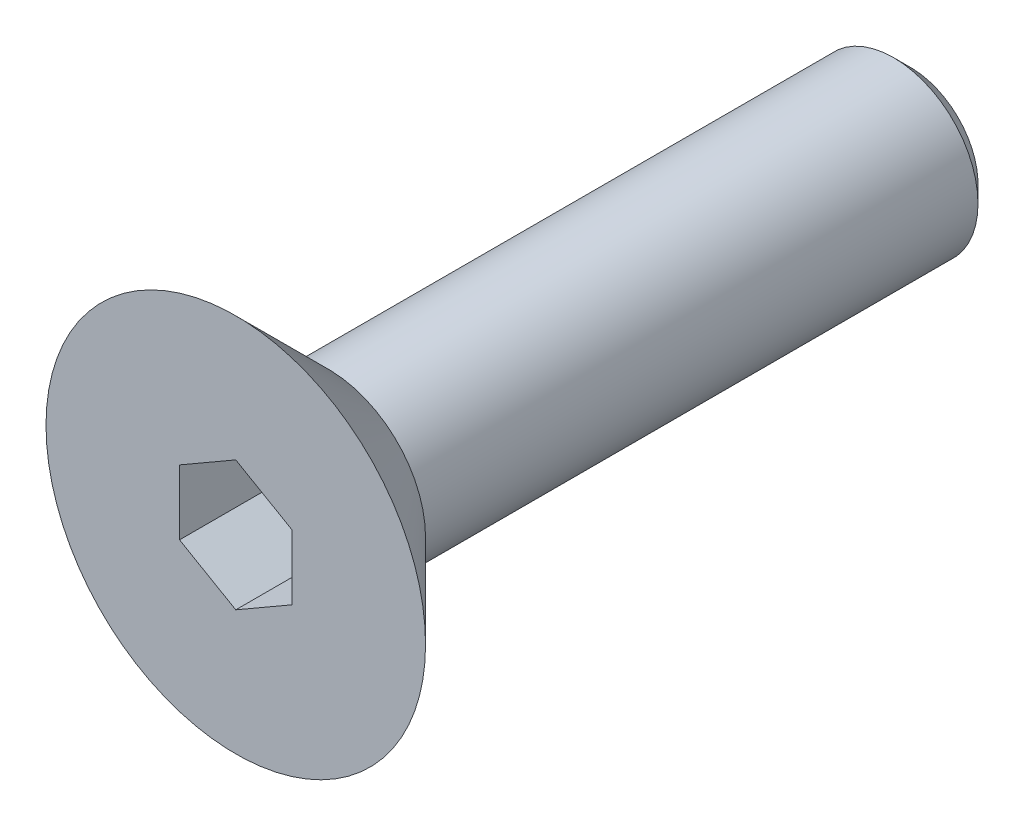
from build123d import *

# Parameters (mm, degrees)
SKETCH1_R           = 3.375
BOSS_EXTRUDE1_DEPTH = 1.65
SKETCH2_R           = 1.5
BOSS_EXTRUDE2_DEPTH = 10.35
CHAMFER1_SIZE       = 0.3
CUT_EXTRUDE1_DEPTH  = 2
CHAMFER2_SIZE       = 1.65


with BuildPart() as part:
    # Sketch1 → Boss-Extrude1 (new body)
    with BuildSketch(Plane.XY):
        Circle(SKETCH1_R)
    extrude(amount=BOSS_EXTRUDE1_DEPTH)

    # Sketch2 → Boss-Extrude2 (add)
    with BuildSketch(Plane(origin=(0, 0, 0), x_dir=(-1, 0, 0), z_dir=(0, 0, -1))):
        with Locations(Location((0, 0, 0), (0, 0, 180))):
            Circle(SKETCH2_R)
    extrude(amount=BOSS_EXTRUDE2_DEPTH)

    # Chamfer1
    chamfer1_edges = [part.edges().sort_by_distance(p)[0] for p in [
        (-1.5, 0, -10.35),
    ]]
    chamfer(chamfer1_edges, length=CHAMFER1_SIZE)

    # Sketch3 → Cut-Extrude1 (cut)
    with BuildSketch(Plane.XY.offset(1.65)):
        Polygon((0, 1.154700538), (-1, 0.577350269), (-1, -0.577350269), (0, -1.154700538), (1, -0.577350269), (1, 0.577350269), align=None)
    extrude(amount=-CUT_EXTRUDE1_DEPTH, mode=Mode.SUBTRACT)

    # Chamfer2
    chamfer2_edges = [part.edges().sort_by_distance(p)[0] for p in [
        (-3.375, 0, 0),
    ]]
    chamfer(chamfer2_edges, length=CHAMFER2_SIZE - 0.0001)  # a hair under: the kernel refuses the full size


solid = part.part
